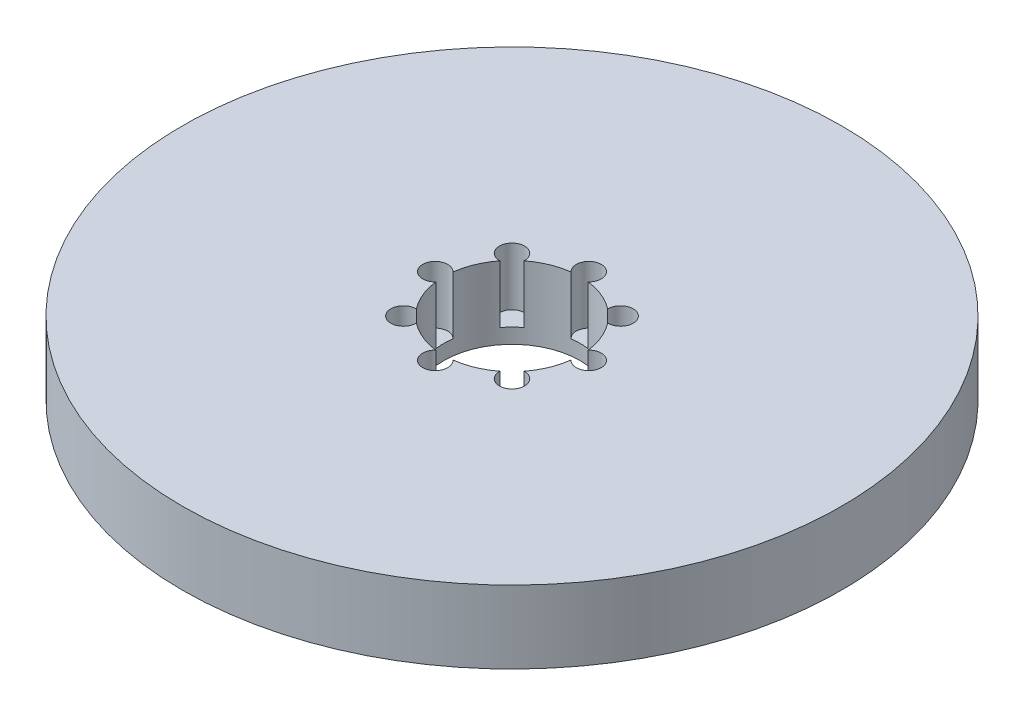
from build123d import *

# Parameters (mm, degrees)
SKETCH1_R           = 72.5
BOSS_EXTRUDE1_DEPTH = 16
SKETCH2_R           = 15
CUT_EXTRUDE1_DEPTH  = 104.771383339
SKETCH3_R           = 2.765679026
CUT_EXTRUDE2_DEPTH  = 12.711692782
CIRPATTERN1_COUNT   = 8


with BuildPart() as part:
    # Sketch1 → Boss-Extrude1 (new body)
    with BuildSketch(Plane(origin=(0, 0, 0), x_dir=(1, 0, 0), z_dir=(0, 1, 0))):
        Circle(SKETCH1_R)
    extrude(amount=BOSS_EXTRUDE1_DEPTH)

    # Sketch2 → Cut-Extrude1 (cut, through all)
    with BuildSketch(Plane(origin=(0, 0, 0), x_dir=(1, 0, 0), z_dir=(0, 1, 0))):
        Circle(SKETCH2_R)
    extrude(amount=CUT_EXTRUDE1_DEPTH, mode=Mode.SUBTRACT)

    # Sketch3 → Cut-Extrude2 (cut)
    with BuildSketch(Plane(origin=(0, 16, 0), x_dir=(1, 0, 0), z_dir=(0, 1, 0))):
        with Locations((-16.896478271, 0)):
            Circle(SKETCH3_R)
    cut_extrude2 = extrude(amount=-CUT_EXTRUDE2_DEPTH, mode=Mode.SUBTRACT)

    # CirPattern1: Cut-Extrude2 ×8 about axis
    cirpattern1_axis = Axis((0, 0, 0), (0, 1, 0))
    for i in range(1, CIRPATTERN1_COUNT):
        add(cut_extrude2.rotate(cirpattern1_axis, i * 360 / CIRPATTERN1_COUNT), mode=Mode.SUBTRACT)


solid = part.part
